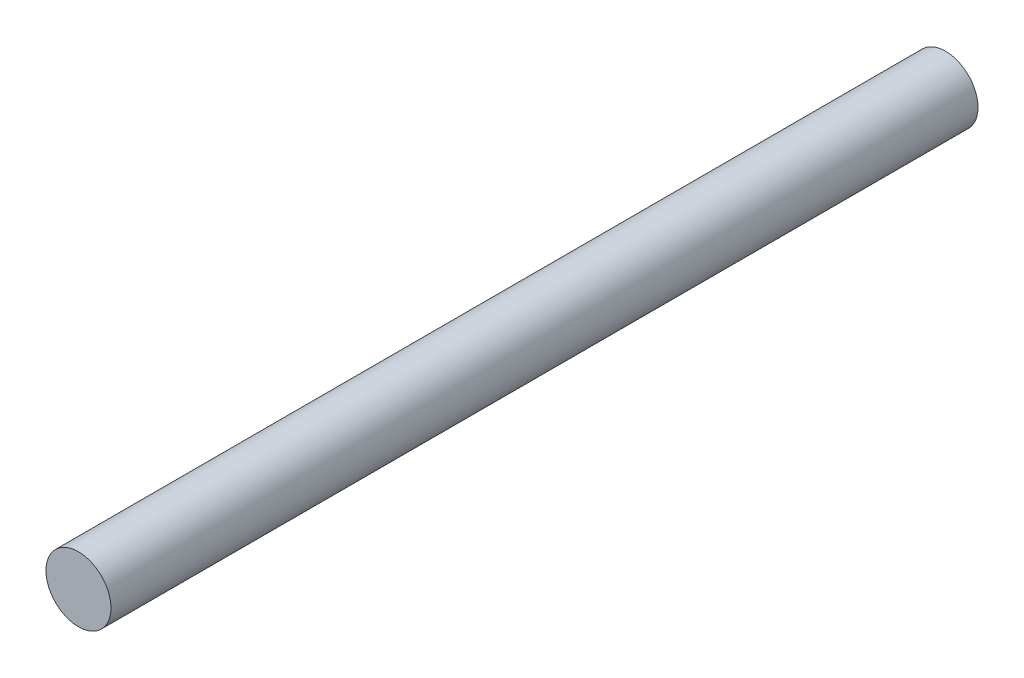
from build123d import *

# Parameters (mm, degrees)
SKETCH1_R           = 1.905
BOSS_EXTRUDE1_DEPTH = 50.8


with BuildPart() as part:
    # Sketch1 → Boss-Extrude1 (new body)
    with BuildSketch(Plane.XY):
        Circle(SKETCH1_R)
    extrude(amount=BOSS_EXTRUDE1_DEPTH)


solid = part.part
